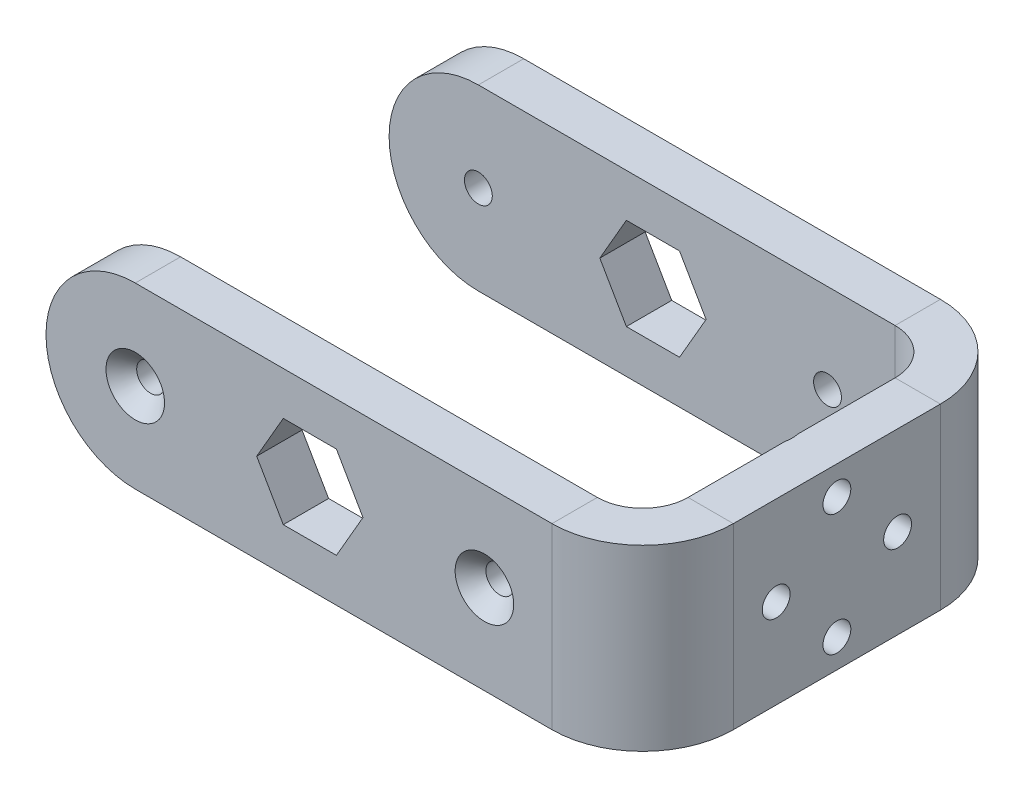
from build123d import *

# Parameters (mm, degrees)
SKETCH2_W                                         = 29
SKETCH2_H                                         = 25
BOSS_EXTRUDE1_DEPTH                               = 6.35
CSK_FOR_M3_5_FLAT_HEAD_MACHINE_SCREW1_D           = 3.9
CSK_FOR_M3_5_FLAT_HEAD_MACHINE_SCREW1_CSINK_D     = 8.2
CSK_FOR_M3_5_FLAT_HEAD_MACHINE_SCREW1_CSINK_ANGLE = 90
EDGE_FLANGE1_DEPTH                                = 25
EDGE_FLANGE1_BEND_DEPTH                           = 25
CSK_FOR_M3_5_FLAT_HEAD_MACHINE_SCREW2_D           = 3.9
CSK_FOR_M3_5_FLAT_HEAD_MACHINE_SCREW2_DEPTH       = 6.35
CSK_FOR_M3_5_FLAT_HEAD_MACHINE_SCREW2_CSINK_D     = 8.2
CSK_FOR_M3_5_FLAT_HEAD_MACHINE_SCREW2_CSINK_ANGLE = 90
CUT_EXTRUDE1_DEPTH                                = 97.44393449
CUT_EXTRUDE2_DEPTH                                = 97.44393449


# Sheet-metal steps are written as plain solids
with BuildPart() as part:
    # Sketch2 → Boss-Extrude1 (new body)
    with BuildSketch(Plane(origin=(0, 0, 0), x_dir=(0, 0, -1), z_dir=(1, 0, 0))):
        Rectangle(SKETCH2_W, SKETCH2_H)
    extrude(amount=BOSS_EXTRUDE1_DEPTH)

    # CSK for M3.5 Flat Head Machine Screw1 (through all)
    with Locations(Plane.ZY):
        with Locations((0, -8.5), (8.5, 0), (0, 8.5), (-8.5, 0)):
            CounterSinkHole(CSK_FOR_M3_5_FLAT_HEAD_MACHINE_SCREW1_D / 2, CSK_FOR_M3_5_FLAT_HEAD_MACHINE_SCREW1_CSINK_D / 2, counter_sink_angle=CSK_FOR_M3_5_FLAT_HEAD_MACHINE_SCREW1_CSINK_ANGLE)

    # Edge-Flange1 section (across the edge) → Edge-Flange1 (add)
    with BuildSketch(Plane(origin=(0, 12.5, -20.85), x_dir=(0, 0, 1), z_dir=(0, -1, 0))):
        with BuildLine():
            Line((-6.35, 6.35), (-6.35, 78.65))
            Line((-6.35, 78.65), (0, 78.65))
            Line((0, 78.65), (0, 6.35))
            ThreePointArc((0, 6.35), (1.859871939, 1.859871939), (6.35, 0))
            Line((6.35, 0), (6.35, -6.35))
            ThreePointArc((6.35, -6.35), (-2.630256121, -2.630256121), (-6.35, 6.35))
        make_face()
    extrude(amount=EDGE_FLANGE1_DEPTH)

    # Edge-Flange1 section 2 (across the edge) → Edge-Flange1 bend (add)
    with BuildSketch(Plane(origin=(0, -12.5, 20.85), x_dir=(0, 0, -1), z_dir=(0, 1, 0))):
        with BuildLine():
            Line((-6.35, 6.35), (-6.35, 78.65))
            Line((-6.35, 78.65), (0, 78.65))
            Line((0, 78.65), (0, 6.35))
            ThreePointArc((0, 6.35), (1.859871939, 1.859871939), (6.35, 0))
            Line((6.35, 0), (6.35, -6.35))
            ThreePointArc((6.35, -6.35), (-2.630256121, -2.630256121), (-6.35, 6.35))
        make_face()
    extrude(amount=EDGE_FLANGE1_BEND_DEPTH)

    # CSK for M3.5 Flat Head Machine Screw2
    with Locations(Plane.XY.offset(27.2)):
        with Locations((-64.709225, 0), (-15.810775, 0)):
            csk_for_m3_5_flat_head_machine_screw2 = CounterSinkHole(CSK_FOR_M3_5_FLAT_HEAD_MACHINE_SCREW2_D / 2, CSK_FOR_M3_5_FLAT_HEAD_MACHINE_SCREW2_CSINK_D / 2, depth=CSK_FOR_M3_5_FLAT_HEAD_MACHINE_SCREW2_DEPTH, counter_sink_angle=CSK_FOR_M3_5_FLAT_HEAD_MACHINE_SCREW2_CSINK_ANGLE)

    # Mirror1: CSK for M3.5 Flat Head Machine Screw2 across plane
    add(csk_for_m3_5_flat_head_machine_screw2.mirror(Plane.XY), mode=Mode.SUBTRACT)

    # Sketch20 → Cut-Extrude1 (cut, through all)
    with BuildSketch(Plane.XY.offset(27.2)):
        Polygon((-32.817666355, 0), (-36.538833178, 6.44525), (-43.981166822, 6.44525), (-47.702333645, 0), (-43.981166822, -6.44525), (-36.538833178, -6.44525), align=None)
    extrude(amount=-CUT_EXTRUDE1_DEPTH, mode=Mode.SUBTRACT)

    # Sketch21 → Cut-Extrude2 (cut, through all)
    with BuildSketch(Plane.XY.offset(27.2)):
        with BuildLine():
            Line((-64.709225, -12.5), (-78.65, -12.5))
            Line((-78.65, -12.5), (-78.65, 12.5))
            Line((-78.65, 12.5), (-64.709225, 12.5))
            ThreePointArc((-64.709225, 12.5), (-77.209225, 0), (-64.709225, -12.5))
        make_face()
    extrude(amount=-CUT_EXTRUDE2_DEPTH, mode=Mode.SUBTRACT)


solid = part.part
